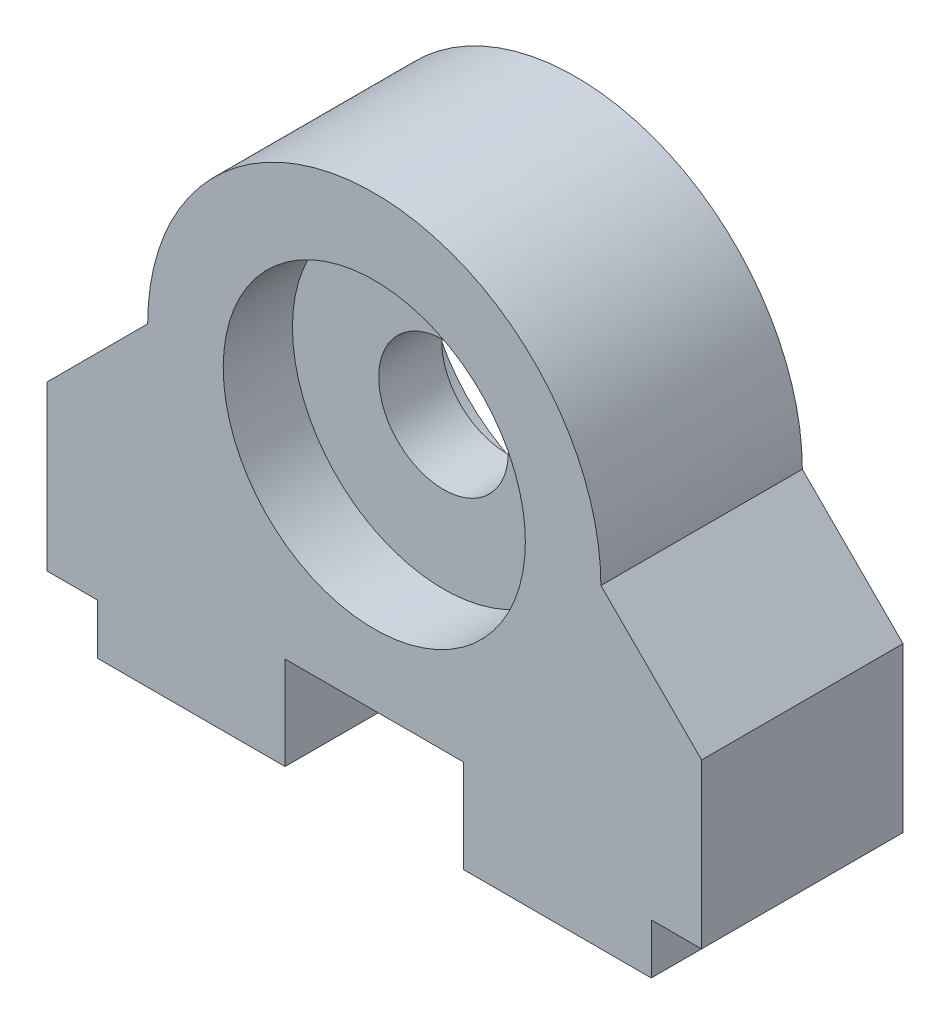
from build123d import *

# Parameters (mm, degrees)
SKETCH1_R                = 7.62
BOSS_EXTRUDE1_DEPTH      = 10.16
BOSS_EXTRUDE2_DEPTH      = 1.5875
BOSS_EXTRUDE2_DEPTH_BACK = 1.5875
SKETCH3_R                = 8.7376
SKETCH3_R_2              = 3.27025
SKETCH4_R                = 1.98374
CUT_EXTRUDE1_DEPTH       = 10.16


with BuildPart() as part:
    # Sketch1 → Boss-Extrude1 (new body)
    with BuildSketch(Plane.XY):
        with BuildLine():
            Line((4.5, 4.699), (-4.5, 4.699))
            Line((-4.5, 4.699), (-4.5, 0))
            Line((-4.5, 0), (-13.97, 0))
            Line((-13.97, 0), (-13.97, 2.54))
            Line((-13.97, 2.54), (-16.51, 2.54))
            Line((-16.51, 2.54), (-16.51, 10.795))
            Line((-16.51, 10.795), (-11.43, 15.875))
            ThreePointArc((-11.43, 15.875), (0, 27.305), (11.43, 15.875))
            Line((11.43, 15.875), (16.51, 10.795))
            Line((16.51, 10.795), (16.51, 2.54))
            Line((16.51, 2.54), (13.97, 2.54))
            Line((13.97, 2.54), (13.97, 0))
            Line((13.97, 0), (4.5, 0))
            Line((4.5, 0), (4.5, 4.699))
        make_face()
        with Locations((0, 15.875)):
            Circle(SKETCH1_R, mode=Mode.SUBTRACT)
    extrude(amount=BOSS_EXTRUDE1_DEPTH)

    # Sketch3 → Boss-Extrude2 (add, two sides: drawn at the far end of the back side and taken through both)
    with BuildSketch(Plane.XY.offset(5.08).offset(-BOSS_EXTRUDE2_DEPTH_BACK)):
        with Locations((0, 15.875)):
            Circle(SKETCH3_R)
        with Locations((0, 15.875)):
            Circle(SKETCH3_R_2, mode=Mode.SUBTRACT)
    extrude(amount=BOSS_EXTRUDE2_DEPTH + BOSS_EXTRUDE2_DEPTH_BACK)

    # Sketch4 → Cut-Extrude1 (cut)
    with BuildSketch(Plane(origin=(0, 0, 0), x_dir=(-1, 0, 0), z_dir=(0, -1, 0))):
        with Locations((-10.16, -3.81)):
            Circle(SKETCH4_R)
        with Locations((10.16, -3.81)):
            Circle(SKETCH4_R)
    extrude(amount=-CUT_EXTRUDE1_DEPTH, mode=Mode.SUBTRACT)


solid = part.part
